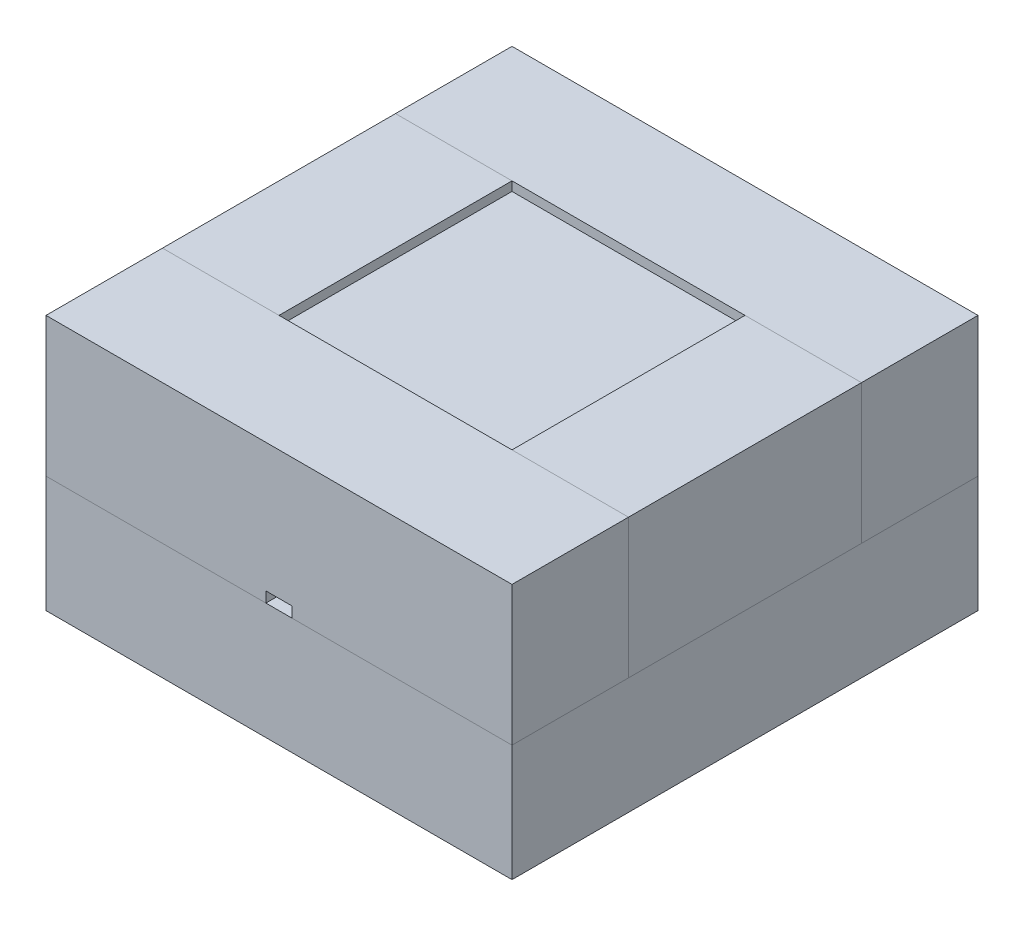
from build123d import *

# Parameters (mm, degrees)
SKETCH1_W            = 50.8
SKETCH1_H            = 50.8
BOSS_EXTRUDE1_DEPTH  = 1.05
SKETCH2_W            = 20
SKETCH2_H            = 31
BOSS_EXTRUDE2_DEPTH  = 2.3
SKETCH4_W            = 5.7
SKETCH4_H            = 2.3
BOSS_EXTRUDE3_DEPTH  = 20
SKETCH5_W            = 50.8
SKETCH5_H            = 50.8
BOSS_EXTRUDE4_DEPTH  = 25
THICKEN1_START       = -27.7
THICKEN1_OUTLINE_W   = 101.6
THICKEN1_OUTLINE_H   = 101.6
THICKEN1_OUTLINE_W_2 = 50.8
THICKEN1_OUTLINE_H_2 = 50.8
THICKEN1_DEPTH       = 55.750000064
THICKEN1_2_OUTLINE_W = 50.8
THICKEN1_2_OUTLINE_H = 50.8
THICKEN1_2_DEPTH     = 25.4
SKETCH6_W            = 5.7
SKETCH6_H            = 2.3
CUT_EXTRUDE1_DEPTH   = 25.4
SPLIT2_START         = -76.2
SPLIT2_OUTLINE_W     = 101.6
SPLIT2_OUTLINE_H     = 30.350000064
SPLIT2_DEPTH         = 76.2
SPLIT2_START_2       = -50.8
SPLIT2_2_OUTLINE_W   = 25.4
SPLIT2_2_OUTLINE_H   = 30.350000064
SPLIT2_2_DEPTH       = 50.8
SPLIT2_3_OUTLINE_W   = 25.4
SPLIT2_3_OUTLINE_H   = 30.350000064
SPLIT2_3_DEPTH       = 50.8
SPLIT2_START_3       = -25.4
SPLIT2_4_OUTLINE_W   = 30.350000064
SPLIT2_4_OUTLINE_H   = 25.4
SPLIT2_4_DEPTH       = 101.6


# Read off the part's stored shape, not the designer's step: Thicken1, Split2
with BuildPart() as part:
    # Sketch1 → Boss-Extrude1 (new body)
    with BuildSketch(Plane(origin=(0, 0, 0), x_dir=(1, 0, 0), z_dir=(0, 1, 0))):
        with Locations((25.4, 25.4)):
            Rectangle(SKETCH1_W, SKETCH1_H)
    extrude(amount=BOSS_EXTRUDE1_DEPTH)

    # Sketch2 → Boss-Extrude2 (add)
    with BuildSketch(Plane.XZ):
        with Locations((25.4, -15.5)):
            Rectangle(SKETCH2_W, SKETCH2_H)
    extrude(amount=BOSS_EXTRUDE2_DEPTH)

    # Sketch4 → Boss-Extrude3 (add)
    with BuildSketch(Plane.XY):
        with Locations((25.4, -1.15)):
            Rectangle(SKETCH4_W, SKETCH4_H)
    extrude(amount=BOSS_EXTRUDE3_DEPTH)


with BuildPart() as body_2:
    # Sketch5 → Boss-Extrude4 (new body)
    with BuildSketch(Plane(origin=(0, 1.05, 0), x_dir=(1, 0, 0), z_dir=(0, 1, 0))):
        with Locations((25.4, 25.4)):
            Rectangle(SKETCH5_W, SKETCH5_H)
    extrude(amount=BOSS_EXTRUDE4_DEPTH)


with BuildPart() as body_3:
    # Thicken1 outline → Thicken1 (new body)
    with BuildSketch(Plane(origin=(0, 0, 0), x_dir=(1, 0, 0), z_dir=(0, 1, 0)).offset(THICKEN1_START)):
        with Locations((25.4, 25.4)):
            Rectangle(THICKEN1_OUTLINE_W, THICKEN1_OUTLINE_H)
        with Locations((25.4, 25.4)):
            Rectangle(THICKEN1_OUTLINE_W_2, THICKEN1_OUTLINE_H_2, mode=Mode.SUBTRACT)
    extrude(amount=THICKEN1_DEPTH)

    # Thicken1 2 outline → Thicken1 2 (add)
    with BuildSketch(Plane(origin=(0, 0, 0), x_dir=(1, 0, 0), z_dir=(0, 1, 0)).offset(THICKEN1_START)):
        with Locations((25.4, 25.4)):
            Rectangle(THICKEN1_2_OUTLINE_W, THICKEN1_2_OUTLINE_H)
    extrude(amount=THICKEN1_2_DEPTH)

    # Sketch6 → Cut-Extrude1 (cut)
    with BuildSketch(Plane.XY.offset(25.4)):
        with Locations((25.4, -1.15)):
            Rectangle(SKETCH6_W, SKETCH6_H)
    extrude(amount=-CUT_EXTRUDE1_DEPTH, mode=Mode.SUBTRACT)


with BuildPart() as body_4:
    # Split1: the piece on the far side of the plane
    add(body_3.part)
    split(bisect_by=Plane.ZX.offset(-2.3), keep=Keep.BOTTOM)


with BuildPart() as body_3_1:
    add(body_3.part)

    # Split1
    split(bisect_by=Plane.ZX.offset(-2.3), keep=Keep.TOP)

    # Split2 outline → Split2 (cut)
    with BuildSketch(Plane.XY.offset(SPLIT2_START)):
        with Locations((25.4, 12.875000032)):
            Rectangle(SPLIT2_OUTLINE_W, SPLIT2_OUTLINE_H)
    extrude(amount=SPLIT2_DEPTH, mode=Mode.SUBTRACT)


with BuildPart() as body_5:
    # Split2 2 outline → Split2 2 (new body)
    with BuildSketch(Plane.XY.offset(SPLIT2_START_2)):
        with Locations((63.5, 12.875000032)):
            Rectangle(SPLIT2_2_OUTLINE_W, SPLIT2_2_OUTLINE_H)
    extrude(amount=SPLIT2_2_DEPTH)


with BuildPart() as body_6:
    # Split2 3 outline → Split2 3 (new body)
    with BuildSketch(Plane.XY.offset(SPLIT2_START_2)):
        with Locations((-12.7, 12.875000032)):
            Rectangle(SPLIT2_3_OUTLINE_W, SPLIT2_3_OUTLINE_H)
    extrude(amount=SPLIT2_3_DEPTH)


with BuildPart() as body_7:
    # Split2 4 outline → Split2 4 (new body)
    with BuildSketch(Plane.YZ.offset(SPLIT2_START_3)):
        with Locations((12.875000032, -63.5)):
            Rectangle(SPLIT2_4_OUTLINE_W, SPLIT2_4_OUTLINE_H)
    extrude(amount=SPLIT2_4_DEPTH)


solid = Compound([part.part, body_2.part, body_4.part, body_3_1.part, body_5.part, body_6.part, body_7.part])
